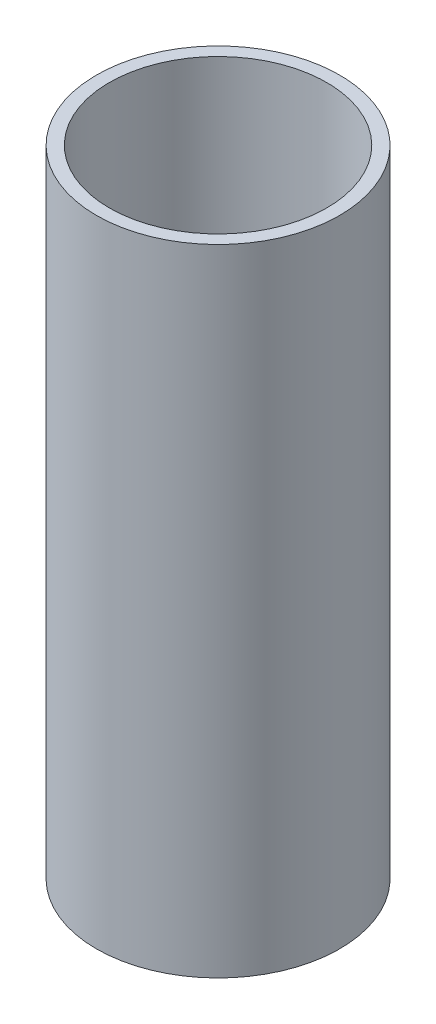
from build123d import *

# Parameters (mm, degrees)
SKETCH1_R           = 40
BOSS_EXTRUDE1_DEPTH = 208.926332131
SKETCH2_R           = 35.752407654
CUT_EXTRUDE1_DEPTH  = 217.449098538


with BuildPart() as part:
    # Sketch1 → Boss-Extrude1 (new body)
    with BuildSketch(Plane(origin=(0, 0, 0), x_dir=(1, 0, 0), z_dir=(0, 1, 0))):
        Circle(SKETCH1_R)
    extrude(amount=BOSS_EXTRUDE1_DEPTH)

    # Sketch2 → Cut-Extrude1 (cut, through all)
    with BuildSketch(Plane(origin=(0, 0, 0), x_dir=(1, 0, 0), z_dir=(0, 1, 0))):
        Circle(SKETCH2_R)
    extrude(amount=CUT_EXTRUDE1_DEPTH, mode=Mode.SUBTRACT)


solid = part.part
